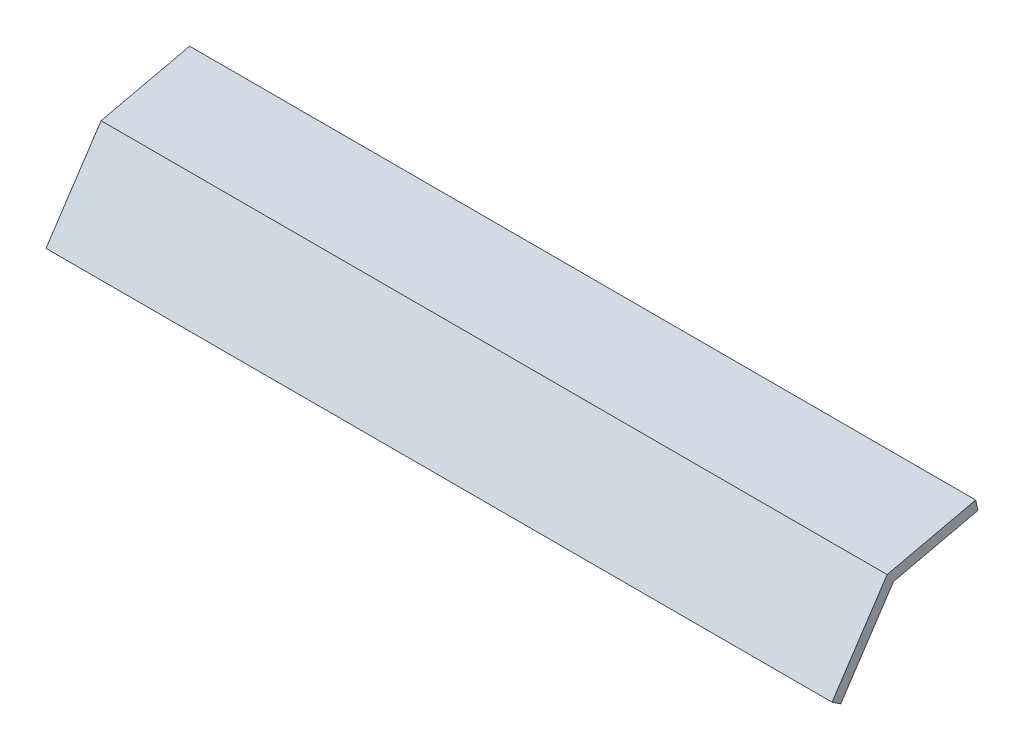
from build123d import *

# Parameters (mm, degrees)
BOSS_EXTRUDE1_DEPTH = 119.85625


with BuildPart() as part:
    # Sketch1 → Boss-Extrude1 (new, symmetric)
    with BuildSketch(Plane(origin=(0, 0, 0), x_dir=(0, 0, -1), z_dir=(1, 0, 0))):
        Polygon((0, 0), (16.798404398, 25.304337045), (43.798204724, 31.499683143), (44.508283384, 28.405105095), (18.743041181, 22.49303942), (2.645187608, -1.756020364), align=None)
    extrude(amount=BOSS_EXTRUDE1_DEPTH, both=True)


solid = part.part
